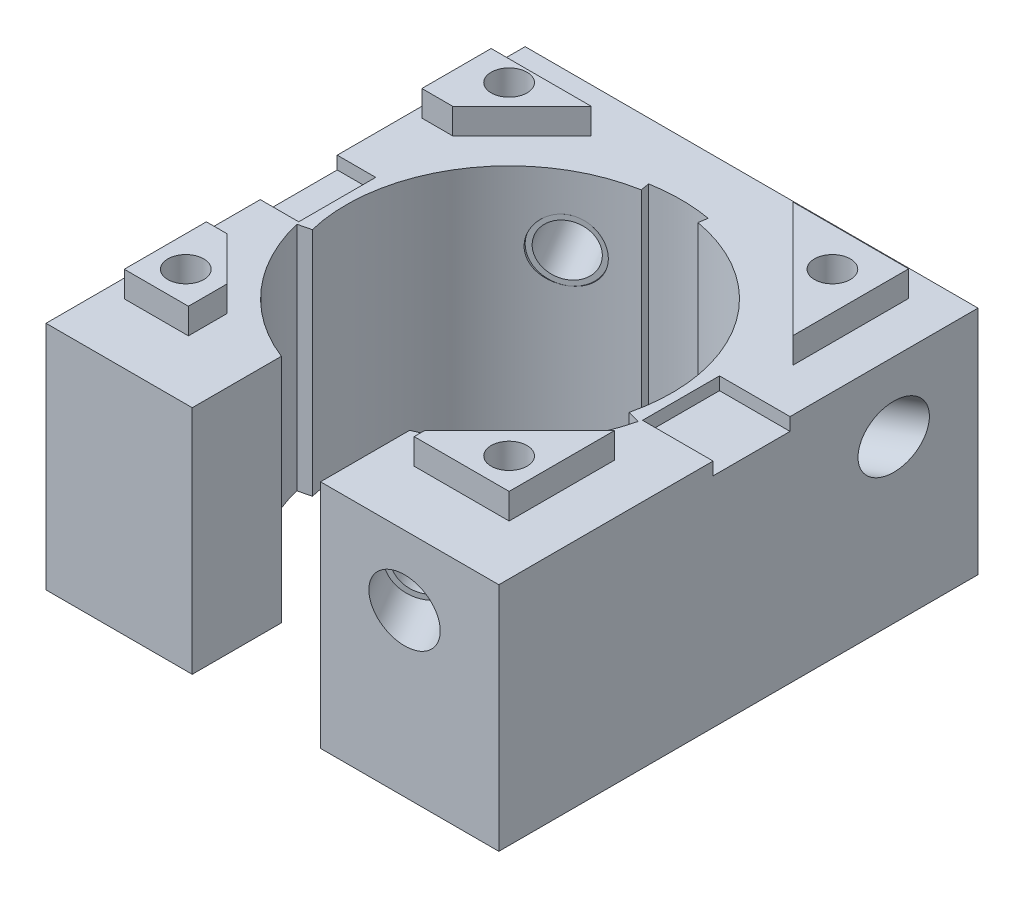
from build123d import *

# Parameters (mm, degrees)
SKETCH1_W                 = 41.656
SKETCH1_H                 = 45.847
BOSS_EXTRUDE1_DEPTH       = 25.4
SKETCH2_R                 = 16.129
CUT_EXTRUDE1_DEPTH        = 25.4
CUT_EXTRUDE2_DEPTH        = 3.81
CUT_EXTRUDE6_START        = -25.4
CUT_EXTRUDE6_DEPTH        = 25.4
CUT_EXTRUDE7_REACH        = 58.4
CUT_EXTRUDE7_END_RADIUS   = 16.129
SKETCH7_R                 = 3.048
SKETCH14_W                = 2.524584731
SKETCH14_H                = 21.209
SKETCH14_W_2              = 2.54
SKETCH14_W_3              = 7.43654476
SKETCH14_H_2              = 2.672753785
CUT_EXTRUDE10_DEPTH       = 2.54
SKETCH17_W                = 45.847
SKETCH17_H                = 22.86
BOSS_EXTRUDE3_DEPTH       = 3.175
CUT_EXTRUDE12_REACH       = 43.576
SKETCH12_R                = 3.048
SKETCH18_W                = 44.831
SKETCH18_H                = 22.86
BOSS_EXTRUDE4_DEPTH       = 1.5875
CUT_EXTRUDE13_DEPTH       = 44.190833792
CUT_EXTRUDE13_DEPTH_BACK  = 44.190833792
SKETCH11_R                = 3.048
SKETCH4_R                 = 1.778
CUT_EXTRUDE14_DEPTH       = 43.685983001
SKETCH19_R                = 3.175
SKETCH19_R_2              = 2.54
BOSS_EXTRUDE5_DEPTH       = 7.112
CIRPATTERN3_START         = 14.321246389
CIRPATTERN3_OUTLINE_R     = 3.048
CIRPATTERN3_OUTLINE_R_2   = 2.54
CIRPATTERN3_DEPTH         = 7.112
CIRPATTERN3_START_2       = 17.188786362
CIRPATTERN3_2_OUTLINE_R   = 3.048
CIRPATTERN3_2_OUTLINE_R_2 = 2.54
CIRPATTERN3_2_DEPTH       = 7.112
CIRPATTERN3_START_3       = 14.033500302
CIRPATTERN3_3_OUTLINE_W   = 10
CIRPATTERN3_3_OUTLINE_H   = 10
CIRPATTERN3_3_OUTLINE_R   = 2.54
CIRPATTERN3_3_DEPTH       = 7.112
SKETCH20_W                = 1.508584731
SKETCH20_H                = 6.858
SKETCH20_W_2              = 0.746584731
SKETCH20_H_2              = 8.128
BOSS_EXTRUDE6_DEPTH       = 2.54
SKETCH20_5_W              = 7.43654476
SKETCH20_5_H              = 2.672753785
CUT_EXTRUDE17_DEPTH       = 2.54
SKETCH21_W                = 3.175
SKETCH21_H                = 7.62
CUT_EXTRUDE18_DEPTH       = 1.27
CUT_EXTRUDE19_DEPTH       = 22.86


# Read off the part's stored shape, not the designer's step: CirPattern3
with BuildPart() as part:
    # Sketch1 → Boss-Extrude1 (new body)
    with BuildSketch(Plane(origin=(0, 0, 0), x_dir=(1, 0, 0), z_dir=(0, 1, 0))):
        Rectangle(SKETCH1_W, SKETCH1_H)
    extrude(amount=BOSS_EXTRUDE1_DEPTH)

    # Sketch2 → Cut-Extrude1 (cut)
    with BuildSketch(Plane(origin=(0, 25.4, 0), x_dir=(1, 0, 0), z_dir=(0, 1, 0))):
        with Locations(Location((0, 2.0955, 0), (0, 0, 270))):
            Circle(SKETCH2_R)
    extrude(amount=-CUT_EXTRUDE1_DEPTH, mode=Mode.SUBTRACT)

    # Sketch3 → Cut-Extrude2 (cut)
    with BuildSketch(Plane(origin=(0, 25.4, 0), x_dir=(1, 0, 0), z_dir=(0, 1, 0))):
        Polygon((17.018, -1.7145), (19.812, -1.7145), (20.828, -1.7145), (20.828, 5.9055), (17.018, 5.9055), align=None)
        Polygon((-17.018, 5.9055), (-19.812, 5.9055), (-20.828, 5.9055), (-20.828, -1.7145), (-19.812, -1.7145), (-17.018, -1.7145), align=None)
    extrude(amount=-CUT_EXTRUDE2_DEPTH, mode=Mode.SUBTRACT)

    # Sketch6 → Cut-Extrude6 (cut)
    with BuildSketch(Plane(origin=(0, 25.4, 0), x_dir=(1, 0, 0), z_dir=(0, 1, 0)).offset(CUT_EXTRUDE6_START)):
        with BuildLine():
            ThreePointArc((-2.800771458, 17.979464248), (-1.405734975, 18.163124286), (0, 18.2245))
            ThreePointArc((0, 18.2245), (1.405734975, 18.163124286), (2.800771458, 17.979464248))
            Line((2.800771458, 17.979464248), (2.955144688, 18.854958341))
            ThreePointArc((2.955144688, 18.854958341), (0, 19.1135), (-2.955144688, 18.854958341))
            Line((-2.955144688, 18.854958341), (-2.800771458, 17.979464248))
        make_face()
        with BuildLine():
            Line((0, 18.2245), (0, 2.0955))
            Line((0, 2.0955), (2.800771458, 17.979464248))
            ThreePointArc((2.800771458, 17.979464248), (1.405734975, 18.163124286), (0, 18.2245))
        make_face()
        with BuildLine():
            Line((-2.800771458, 17.979464248), (0, 2.0955))
            Line((0, 2.0955), (0, 18.2245))
            ThreePointArc((0, 18.2245), (-1.405734975, 18.163124286), (-2.800771458, 17.979464248))
        make_face()
    extrude(amount=CUT_EXTRUDE6_DEPTH, mode=Mode.SUBTRACT)

    # Cut-Extrude7: up to this cylinder (the profile starts outside it)
    cut_extrude7_end = Plane(origin=(0, 16.002, -2.0955), z_dir=(0, 1, 0)) * Cylinder(CUT_EXTRUDE7_END_RADIUS, 150.058, mode=Mode.PRIVATE)
    # Sketch7 → Cut-Extrude7 (cut, up to the surface)
    with BuildSketch(Plane.XY.offset(22.9235), mode=Mode.PRIVATE) as cut_extrude7_sk1:
        with Locations((0, 16.002)):
            Circle(SKETCH7_R)
    cut_extrude7_tool1 = extrude(cut_extrude7_sk1.sketch, amount=-CUT_EXTRUDE7_REACH, mode=Mode.PRIVATE) - cut_extrude7_end
    add(cut_extrude7_tool1.solids().sort_by_distance((0, 16.002, 22.9235))[0], mode=Mode.SUBTRACT)

    # Sketch14 → Cut-Extrude10 (cut)
    with BuildSketch(Plane(origin=(0, 25.4, 0), x_dir=(1, 0, 0), z_dir=(0, 1, 0))):
        Polygon((20.828, 22.9235), (-20.828, 22.9235), (-20.828, 5.9055), (-18.303415269, 5.9055), (-18.303415269, 20.3835), (20.828, 20.3835), align=None)
        with Locations((-19.565707635, -12.319)):
            Rectangle(SKETCH14_W, SKETCH14_H)
        with Locations((19.558, -12.319)):
            Rectangle(SKETCH14_W_2, SKETCH14_H)
        with Locations((0, -20.25731759)):
            Rectangle(SKETCH14_W_3, SKETCH14_H_2)
    extrude(amount=-CUT_EXTRUDE10_DEPTH, mode=Mode.SUBTRACT)

    # Sketch17 → Boss-Extrude3 (add)
    with BuildSketch(Plane(origin=(20.828, 0, 0), x_dir=(0, 0, -1), z_dir=(1, 0, 0))):
        with Locations((0, 11.43)):
            Rectangle(SKETCH17_W, SKETCH17_H)
    extrude(amount=BOSS_EXTRUDE3_DEPTH)

    # Cut-Extrude12: up to this plane
    cut_extrude12_end = Plane(origin=(24.003, 0, 0), z_dir=(1, 0, 0))
    # Sketch12 → Cut-Extrude12 (cut, up to the surface)
    with BuildSketch(Plane(origin=(0.914260378, 0, -0.535980498), x_dir=(-0.50574390925612, 0, -0.862683660590797), z_dir=(0.862683660590797, 0, -0.50574390925612)), mode=Mode.PRIVATE) as cut_extrude12_sk1:
        with Locations(Location((1.807753611, 16.002, 0), (0, 0, 180))):
            Circle(SKETCH12_R)
    cut_extrude12_tool1 = split(extrude(cut_extrude12_sk1.sketch, amount=CUT_EXTRUDE12_REACH, mode=Mode.PRIVATE), bisect_by=cut_extrude12_end, keep=Keep.BOTH, mode=Mode.PRIVATE)
    add(cut_extrude12_tool1.solids().sort_by_distance((0, 16.002, -2.0955))[0], mode=Mode.SUBTRACT)

    # Sketch18 → Boss-Extrude4 (add)
    with BuildSketch(Plane(origin=(0, 0, -22.9235), x_dir=(-1, 0, 0), z_dir=(0, 0, -1))):
        with Locations((-1.5875, 11.43)):
            Rectangle(SKETCH18_W, SKETCH18_H)
    extrude(amount=BOSS_EXTRUDE4_DEPTH)

    # Sketch11 → Cut-Extrude13 (cut, two sides: drawn at the far end of the back side and taken through both)
    with BuildSketch(Plane(origin=(-0.914260378, 0, -1.559519502), x_dir=(0.862683660590797, 0, -0.50574390925612), z_dir=(0.50574390925612, 0, 0.862683660590797)).offset(-CUT_EXTRUDE13_DEPTH_BACK)):
        with Locations((1.059786362, 16.002)):
            Circle(SKETCH11_R)
    extrude(amount=CUT_EXTRUDE13_DEPTH + CUT_EXTRUDE13_DEPTH_BACK, mode=Mode.SUBTRACT)

    # Sketch4 → Cut-Extrude14 (cut, through all)
    with BuildSketch(Plane(origin=(0, 25.4, 0), x_dir=(1, 0, 0), z_dir=(0, 1, 0))):
        with Locations(Location((-16.002, -13.9065, 0), (0, 0, 270))):
            Circle(SKETCH4_R)
        with Locations(Location((-16.002, 18.0975, 0), (0, 0, 90))):
            Circle(SKETCH4_R)
        with Locations(Location((16.002, 18.0975, 0), (0, 0, 270))):
            Circle(SKETCH4_R)
        with Locations(Location((16.002, -13.9065, 0), (0, 0, 90))):
            Circle(SKETCH4_R)
    extrude(amount=-CUT_EXTRUDE14_DEPTH, mode=Mode.SUBTRACT)

    # Sketch19 → Boss-Extrude5 (add)
    with BuildSketch(Plane(origin=(-9.07140389, 0, -15.473744264), x_dir=(0.8626836605907969, 0, -0.5057439092561202), z_dir=(0.5057439092561202, 0, 0.8626836605907969))):
        with Locations((1.059786362, 16.002)):
            Circle(SKETCH19_R)
        with Locations((1.059786362, 16.002)):
            Circle(SKETCH19_R_2, mode=Mode.SUBTRACT)
    extrude(amount=-BOSS_EXTRUDE5_DEPTH)

    # CirPattern3 outline → CirPattern3 (add)
    with BuildSketch(Plane(origin=(0, 0, 0), x_dir=(0.8626836605907969, 0, -0.5057439092561199), z_dir=(0.50574390925612, 0, 0.862683660590797)).offset(CIRPATTERN3_START)):
        with Locations((1.059786362, 16.002)):
            Circle(CIRPATTERN3_OUTLINE_R)
        with Locations((1.059786362, 16.002)):
            Circle(CIRPATTERN3_OUTLINE_R_2, mode=Mode.SUBTRACT)
    extrude(amount=CIRPATTERN3_DEPTH)

    # CirPattern3 2 outline → CirPattern3 2 (add)
    with BuildSketch(Plane(origin=(0, 0, 0), x_dir=(0.5057439092561169, 0, 0.8626836605907988), z_dir=(0.8626836605907988, 0, -0.5057439092561169)).offset(CIRPATTERN3_START_2)):
        with Locations((-1.807753611, -16.002)):
            Circle(CIRPATTERN3_2_OUTLINE_R)
        with Locations((-1.807753611, -16.002)):
            Circle(CIRPATTERN3_2_OUTLINE_R_2, mode=Mode.SUBTRACT)
    extrude(amount=CIRPATTERN3_2_DEPTH)

    # CirPattern3 3 outline → CirPattern3 3 (add)
    with BuildSketch(Plane(origin=(0, 0, 0), x_dir=(0.9999998560090501, 0, -0.0005366394310553081), z_dir=(0.0005366394310553081, 0, 0.9999998560090502)).offset(CIRPATTERN3_START_3)):
        with Locations((0, 16)):
            Rectangle(CIRPATTERN3_3_OUTLINE_W, CIRPATTERN3_3_OUTLINE_H)
        with Locations((0.001124528, 16.002)):
            Circle(CIRPATTERN3_3_OUTLINE_R, mode=Mode.SUBTRACT)
    extrude(amount=CIRPATTERN3_3_DEPTH)

    # Sketch20 → Boss-Extrude6 (add)
    with BuildSketch(Plane(origin=(0, 25.4, 0), x_dir=(1, 0, 0), z_dir=(0, 1, 0))):
        Polygon((9.835016705, 20.3835), (19.741016705, 20.3835), (19.741016705, 21.9075), (8.311016705, 21.9075), align=None)
        with Locations((-19.057707635, 16.7005)):
            Rectangle(SKETCH20_W, SKETCH20_H)
        Polygon((19.05, -6.5405), (18.288, -7.3025), (18.288, -16.9545), (19.05, -16.9545), align=None)
        with Locations((-18.676707635, -12.8905)):
            Rectangle(SKETCH20_W_2, SKETCH20_H_2)
    extrude(amount=-BOSS_EXTRUDE6_DEPTH)

    # Sketch20<5> → Cut-Extrude17 (cut)
    with BuildSketch(Plane(origin=(0, 25.4, 0), x_dir=(1, 0, 0), z_dir=(0, 1, 0))):
        Polygon((19.741016705, 20.3835), (19.741016705, 18.0975), (19.741016705, 10.4775), (9.835016705, 20.3835), (-18.303415269, 20.3835), (-18.303415269, 20.1295), (-16.002, 20.1295), (-9.906, 20.1295), (-16.764, 13.2715), (-18.303415269, 13.2715), (-18.303415269, 5.9055), (-17.018, 5.9055), (-17.018, -1.7145), (-18.303415269, -1.7145), (-18.303415269, -8.8265), (-17.018, -8.8265), (-12.7, -13.1445), (-12.7, -16.9545), (-16.002, -16.9545), (-18.303415269, -16.9545), (-18.303415269, -22.9235), (18.288, -22.9235), (18.288, -16.9545), (16.002, -16.9545), (9.652, -16.9545), (9.652, -15.9385), (18.288, -7.3025), (18.288, -1.7145), (17.018, -1.7145), (17.018, 5.9055), (20.828, 5.9055), (20.828, 20.3835), align=None)
        with Locations((0, -20.25731759)):
            Rectangle(SKETCH20_5_W, SKETCH20_5_H, mode=Mode.SUBTRACT)
        with BuildLine():
            ThreePointArc((2.800771458, 17.979464248), (0, -14.0335), (-2.800771458, 17.979464248))
            Line((-2.800771458, 17.979464248), (-2.955144688, 18.854958341))
            ThreePointArc((-2.955144688, 18.854958341), (0, 19.1135), (2.955144688, 18.854958341))
            Line((2.955144688, 18.854958341), (2.800771458, 17.979464248))
        make_face(mode=Mode.SUBTRACT)
    extrude(amount=-CUT_EXTRUDE17_DEPTH, mode=Mode.SUBTRACT)

    # Sketch21 → Cut-Extrude18 (cut)
    with BuildSketch(Plane(origin=(0, 22.86, 0), x_dir=(1, 0, 0), z_dir=(0, 1, 0))):
        with Locations((22.4155, 2.0955)):
            Rectangle(SKETCH21_W, SKETCH21_H)
    extrude(amount=-CUT_EXTRUDE18_DEPTH, mode=Mode.SUBTRACT)

    # Sketch22 → Cut-Extrude19 (cut)
    with BuildSketch(Plane(origin=(0, 22.86, 0), x_dir=(1, 0, 0), z_dir=(0, 1, 0))):
        with BuildLine():
            ThreePointArc((15.672540987, -1.7145), (0, -14.0335), (-15.672540987, -1.7145))
            Line((-15.672540987, -1.7145), (-16.906599333, -2.0145))
            ThreePointArc((-16.906599333, -2.0145), (-13.10543472, -9.348834048), (-6.35, -14.103348755))
            Line((-6.35, -14.103348755), (-6.35, -22.9235))
            Line((-6.35, -22.9235), (6.35, -22.9235))
            Line((6.35, -22.9235), (6.35, -14.103348755))
            ThreePointArc((6.35, -14.103348755), (13.10543472, -9.348834048), (16.906599333, -2.0145))
            Line((16.906599333, -2.0145), (15.672540987, -1.7145))
        make_face()
    extrude(amount=-CUT_EXTRUDE19_DEPTH, mode=Mode.SUBTRACT)


solid = part.part
